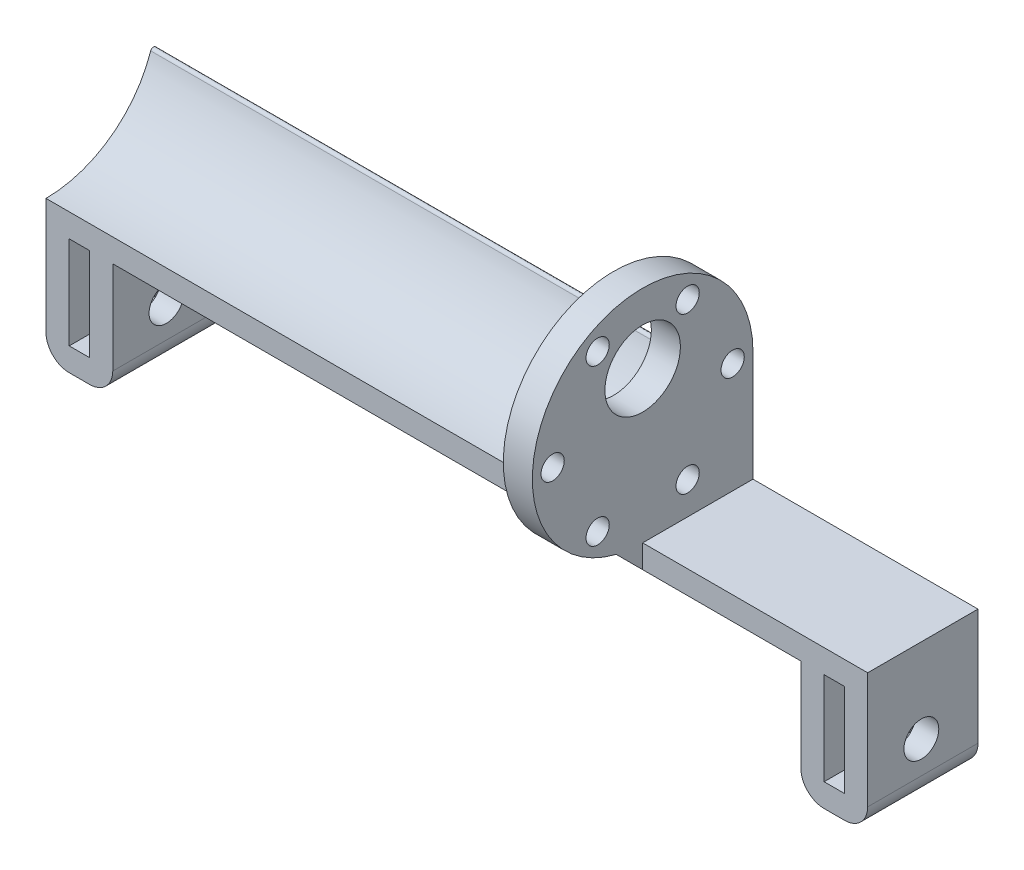
from build123d import *

# Parameters (mm, degrees)
SKETCH1_W               = 3.5
SKETCH1_H               = 15.967998052
BOSS_EXTRUDE1_DEPTH     = 19
BOSS_EXTRUDE2_START     = 27
SKETCH2_R               = 6.5
SKETCH2_R_2             = 2
BOSS_EXTRUDE2_DEPTH     = 5
BOSS_EXTRUDE3_DEPTH     = 97.75
FILLET1_START           = -72
FILLET1_DEPTH           = 99
CUT_EXTRUDE1_DEPTH      = 85.442658059
CUT_EXTRUDE1_DEPTH_BACK = 85.442658059
SKETCH4_R               = 3
CHAMFER1_SIZE           = 4
FILLET3_R               = 4


with BuildPart() as part:
    # Sketch1 → Boss-Extrude1 (new body)
    with BuildSketch(Plane.XY):
        Polygon((-59.25, 0), (59.25, 0), (59.25, -20), (70.75, -20), (70.75, 4), (-70.75, 4), (-70.75, -20), (-59.25, -20), align=None)
        with Locations((65, -8.016000974)):
            Rectangle(SKETCH1_W, SKETCH1_H, mode=Mode.SUBTRACT)
        with Locations((-65, -8.016000974)):
            Rectangle(SKETCH1_W, SKETCH1_H, mode=Mode.SUBTRACT)
    extrude(amount=-BOSS_EXTRUDE1_DEPTH)

    # Sketch2 → Boss-Extrude2 (add)
    with BuildSketch(Plane(origin=(0, 0, 0), x_dir=(0, 0, -1), z_dir=(1, 0, 0)).offset(BOSS_EXTRUDE2_START)):
        with BuildLine():
            Line((19, 4), (19, 23))
            ThreePointArc((19, 23), (-13.435028843, 36.435028843), (0, 4))
            Line((0, 4), (19, 4))
        make_face()
        with Locations((0, 30)):
            Circle(SKETCH2_R, mode=Mode.SUBTRACT)
        with Locations((15.5, 23)):
            Circle(SKETCH2_R_2, mode=Mode.SUBTRACT)
        with Locations((7.75, 9.576606241)):
            Circle(SKETCH2_R_2, mode=Mode.SUBTRACT)
        with Locations((-7.75, 9.576606241)):
            Circle(SKETCH2_R_2, mode=Mode.SUBTRACT)
        with Locations((-15.5, 23)):
            Circle(SKETCH2_R_2, mode=Mode.SUBTRACT)
        with Locations((-7.75, 36.423393759)):
            Circle(SKETCH2_R_2, mode=Mode.SUBTRACT)
        with Locations((7.75, 36.423393759)):
            Circle(SKETCH2_R_2, mode=Mode.SUBTRACT)
    extrude(amount=BOSS_EXTRUDE2_DEPTH)

    # Sketch3 → Boss-Extrude3 (add)
    with BuildSketch(Plane.ZY.offset(70.75)):
        with BuildLine():
            Line((0, 4), (-19, 4))
            Line((-19, 4), (-19, 23))
            ThreePointArc((-19, 23), (-13.435028843, 9.564971157), (0, 4))
        make_face()
    extrude(amount=-BOSS_EXTRUDE3_DEPTH)

    # Fillet1: read off the stored shape, not the designer's step
    # Fillet1 outline → Fillet1 (cut)
    with BuildSketch(Plane.YZ.offset(FILLET1_START)):
        with BuildLine():
            ThreePointArc((23, -19), (19.957565078, -18.754828438), (16.993647895, -18.025641026))
            ThreePointArc((16.993647895, -18.025641026), (17.329134114, -18.580064077), (16.835585997, -19))
            Line((16.835585997, -19), (23, -19))
        make_face()
    extrude(amount=FILLET1_DEPTH, mode=Mode.SUBTRACT)

    # Sketch4 → Cut-Extrude1 (cut, two sides: drawn at the far end of the back side and taken through both)
    with BuildSketch(Plane(origin=(0, 0, 0), x_dir=(0, 0, -1), z_dir=(1, 0, 0)).offset(-CUT_EXTRUDE1_DEPTH_BACK)):
        with Locations((9.246961263, -10.5)):
            Circle(SKETCH4_R)
    extrude(amount=CUT_EXTRUDE1_DEPTH + CUT_EXTRUDE1_DEPTH_BACK, mode=Mode.SUBTRACT)

    # Chamfer1
    # the kernel refuses this chamfer: 4 mm, written as the material it adds along each edge
    with BuildSketch(Plane(origin=(27, 4, 0), x_dir=(0, -1, 0), z_dir=(1, 0, 0))) as chamfer1_piece_1:
        with BuildLine():
            Line((CHAMFER1_SIZE, 0), (-0.553778005, -4.553778005))
            ThreePointArc((-0.553778005, -4.553778005), (-0.146737714, -2.356798922), (0, 0))
            Line((0, 0), (CHAMFER1_SIZE, 0))
        make_face()
    extrude(amount=5)

    # Fillet3
    fillet3_edges = [part.edges().sort_by_distance(p)[0] for p in [
        (59.25, -20, -9.5),
        (-59.25, -20, -9.5),
        (-70.75, -20, -9.5),
        (70.75, -20, -9.5),
    ]]
    fillet(fillet3_edges, radius=FILLET3_R)


solid = part.part
